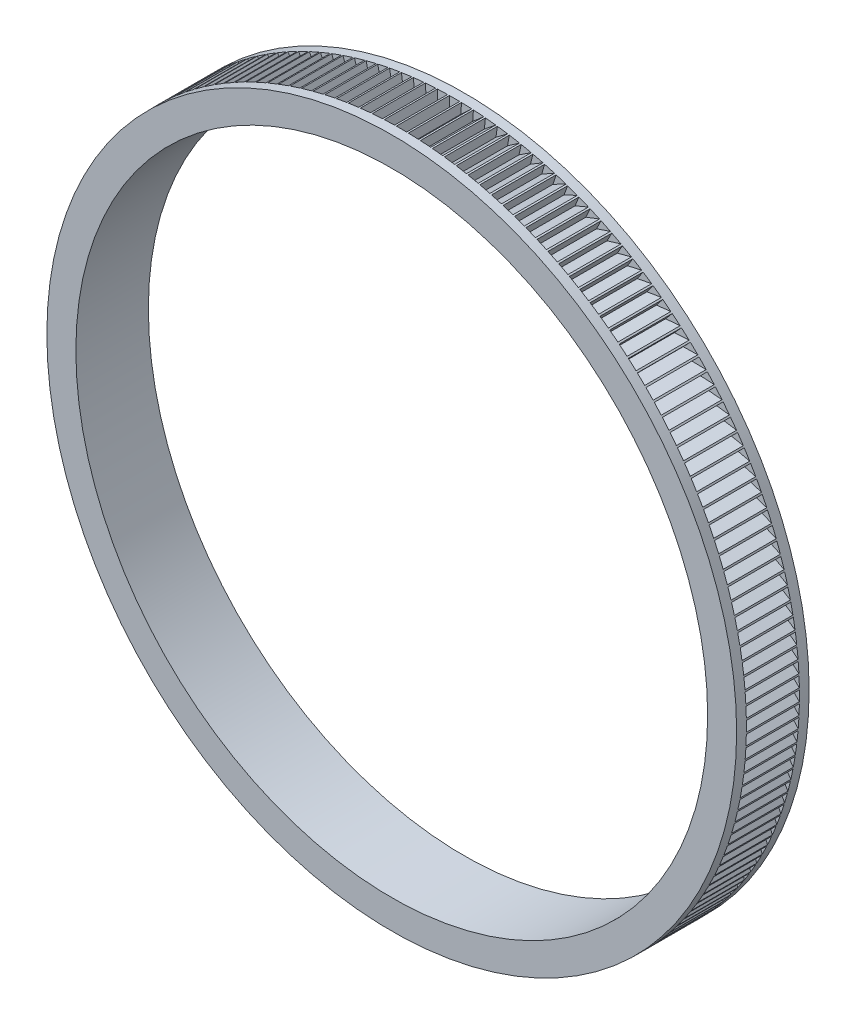
from build123d import *

# Parameters (mm, degrees)
CROQUIS1_R              = 33.3
CROQUIS1_R_2            = 30.5
SALIENTE_EXTRUIR2_DEPTH = 7
CROQUIS5_W              = 1
CROQUIS5_H              = 5.122199178
CORTAR_EXTRUIR5_DEPTH   = 1.8
CHAFL_N2_SIZE           = 1.1
MATRIZC3_START          = 0.938900411
MATRIZC3_DEPTH          = 5.122199178


# Read off the part's stored shape, not the designer's step: MatrizC3
with BuildPart() as part:
    # Croquis1 → Saliente-Extruir2 (new body)
    with BuildSketch(Plane.XY):
        Circle(CROQUIS1_R)
        Circle(CROQUIS1_R_2, mode=Mode.SUBTRACT)
    extrude(amount=SALIENTE_EXTRUIR2_DEPTH)

    # Croquis5 → Cortar-Extruir5 (cut)
    with BuildSketch(Plane(origin=(0, 34, 0), x_dir=(1, 0, 0), z_dir=(0, 1, 0))):
        with Locations((0, -3.5)):
            Rectangle(CROQUIS5_W, CROQUIS5_H)
    extrude(amount=-CORTAR_EXTRUIR5_DEPTH, mode=Mode.SUBTRACT)

    # Chaflán2
    # the kernel refuses this chamfer: 1.1 mm, written as the material it adds along each edge
    with BuildSketch(Plane(origin=(0.5, 32.2, 6.061099589), x_dir=(0.02749587661058642, 0.9996219169112969, 0), z_dir=(0, 0, -1))) as chafl_n2_piece_1_section:
        Polygon((CHAFL_N2_SIZE * 0.999621916911, -CHAFL_N2_SIZE * 0.0274958766106), (-CHAFL_N2_SIZE * 0.0274958766106, -CHAFL_N2_SIZE * 0.999621916911), (0, 0), align=None)
    chafl_n2_piece_1 = extrude(amount=5.122199179, mode=Mode.PRIVATE)
    chafl_n2_piece_1 = chafl_n2_piece_1 & Plane(origin=(0, 0, 3.5), x_dir=(1, 0, 0), z_dir=(0, 0, -1)) * Cylinder(33.3, 15, mode=Mode.PRIVATE)
    add(chafl_n2_piece_1)

    # MatrizC3 outline → MatrizC3 (cut)
    with BuildSketch(Plane.XY.offset(MATRIZC3_START)):
        with BuildLine():
            ThreePointArc((1.658023197, 33.258697495), (1.160304843, 33.279779036), (0.662326815, 33.29341261))
            Line((0.662326815, 33.29341261), (0.62755833, 32.297773461))
            Line((0.62755833, 32.297773461), (1.658023197, 33.258697495))
        make_face()
        with BuildLine():
            Line((-1.626949157, 32.262873964), (-0.666025123, 33.293338831))
            ThreePointArc((-0.666025123, 33.293338831), (-1.164001633, 33.279649941), (-1.661717642, 33.258513113))
            Line((-1.661717642, 33.258513113), (-1.626949157, 32.262873964))
        make_face()
        with BuildLine():
            ThreePointArc((2.817724978, 33.18057302), (2.321045556, 33.219011839), (1.823846687, 33.25001629))
            Line((1.823846687, 33.25001629), (1.754352077, 32.25619706))
            Line((1.754352077, 32.25619706), (2.817724978, 33.18057302))
        make_face()
        with BuildLine():
            Line((-2.751916127, 32.186440587), (-1.827540167, 33.249813487))
            ThreePointArc((-1.827540167, 33.249813487), (-2.324735588, 33.218753806), (-2.821410737, 33.180259816))
            Line((-2.821410737, 33.180259816), (-2.751916127, 32.186440587))
        make_face()
        with BuildLine():
            ThreePointArc((3.973993794, 33.062023128), (3.478958431, 33.117772392), (2.983144483, 33.166109947))
            Line((2.983144483, 33.166109947), (2.879008416, 32.175321452))
            Line((2.879008416, 32.175321452), (3.973993794, 33.062023128))
        make_face()
        with BuildLine():
            Line((-3.873530311, 32.070792989), (-2.986828635, 33.165778367))
            ThreePointArc((-2.986828635, 33.165778367), (-3.482637211, 33.117385737), (-3.977666378, 33.061581483))
            Line((-3.977666378, 33.061581483), (-3.873530311, 32.070792989))
        make_face()
        with BuildLine():
            ThreePointArc((5.125420912, 32.903192254), (4.632632733, 32.976184042), (4.138807777, 33.041795808))
            Line((4.138807777, 33.041795808), (4.000157127, 32.055245171))
            Line((4.000157127, 32.055245171), (5.125420912, 32.903192254))
        make_face()
        with BuildLine():
            Line((-4.990425195, 31.91607207), (-4.142478113, 33.041335855))
            ThreePointArc((-4.142478113, 33.041335855), (-4.636295777, 32.975669235), (-5.129075845, 32.902622707))
            Line((-5.129075845, 32.902622707), (-4.990425195, 31.91607207))
        make_face()
        with BuildLine():
            ThreePointArc((6.270603493, 32.704273908), (5.780662884, 32.794419291), (5.289428571, 32.87722533))
            Line((5.289428571, 32.87722533), (5.116432262, 31.896114511))
            Line((5.116432262, 31.896114511), (6.270603493, 32.704273908))
        make_face()
        with BuildLine():
            Line((-6.101240015, 31.722466333), (-5.293080619, 32.876637565))
            ThreePointArc((-5.293080619, 32.876637565), (-5.784305731, 32.793776959), (-6.274236324, 32.703577152))
            Line((-6.274236324, 32.703577152), (-6.101240015, 31.722466333))
        make_face()
        with BuildLine():
            ThreePointArc((7.408146311, 32.465510442), (6.921650189, 32.572699591), (6.433605011, 32.672599018))
            Line((6.433605011, 32.672599018), (6.226473813, 31.698123349))
            Line((6.226473813, 31.698123349), (7.408146311, 32.465510442))
        make_face()
        with BuildLine():
            Line((-7.204621414, 31.490211658), (-6.437234321, 32.671884156))
            ThreePointArc((-6.437234321, 32.671884156), (-6.925268399, 32.571930517), (-7.411752611, 32.464687327))
            Line((-7.411752611, 32.464687327), (-7.204621414, 31.490211658))
        make_face()
        with BuildLine():
            ThreePointArc((8.536663443, 32.187192752), (8.054204528, 32.311295075), (7.569943094, 32.428166176))
            Line((7.569943094, 32.428166176), (7.328929365, 31.461512907))
            Line((7.328929365, 31.461512907), (8.536663443, 32.187192752))
        make_face()
        with BuildLine():
            Line((-8.299225091, 31.219591011), (-7.573545245, 32.427325089))
            ThreePointArc((-7.573545245, 32.427325089), (-8.057793694, 32.310400195), (-8.54023882, 32.186244281))
            Line((-8.54023882, 32.186244281), (-8.299225091, 31.219591011))
        make_face()
        with BuildLine():
            ThreePointArc((9.654779965, 31.869659926), (9.17694606, 32.010524223), (8.697058368, 32.144224609))
            Line((8.697058368, 32.144224609), (8.422455745, 31.186571457))
            Line((8.422455745, 31.186571457), (9.654779965, 31.869659926))
        make_face()
        with BuildLine():
            Line((-9.383717441, 30.910934101), (-8.700628971, 32.143258321))
            ThreePointArc((-8.700628971, 32.143258321), (-9.180501809, 32.009504628), (-9.658320064, 31.868587254))
            Line((-9.658320064, 31.868587254), (-9.383717441, 30.910934101))
        make_face()
        with BuildLine():
            ThreePointArc((10.761133626, 31.513298829), (10.288506897, 31.670753477), (9.813577615, 31.821120257))
            Line((9.813577615, 31.821120257), (9.50572066, 30.873633974))
            Line((9.50572066, 30.873633974), (10.761133626, 31.513298829))
        make_face()
        with BuildLine():
            Line((-10.456777176, 30.564616979), (-9.817112321, 31.820029945))
            ThreePointArc((-9.817112321, 31.820029945), (-10.292024897, 31.66961041), (-10.764634132, 31.512103262))
            Line((-10.764634132, 31.512103262), (-10.456777176, 30.564616979))
        make_face()
        with BuildLine():
            ThreePointArc((11.854376502, 31.118543631), (11.387532773, 31.292396798), (10.918140531, 31.45924677))
            Line((10.918140531, 31.45924677), (10.577404319, 30.523081723))
            Line((10.577404319, 30.523081723), (11.854376502, 31.118543631))
        make_face()
        with BuildLine():
            Line((-11.51709694, 30.18106158), (-10.921635031, 31.458033763))
            ThreePointArc((-10.921635031, 31.458033763), (-11.391008737, 31.29113165), (-11.857833151, 31.117226627))
            Line((-11.857833151, 31.117226627), (-11.51709694, 30.18106158))
        make_face()
        with BuildLine():
            ThreePointArc((12.933176647, 30.685875282), (12.472684694, 30.875915153), (12.009401373, 31.059045038))
            Line((12.009401373, 31.059045038), (11.63620104, 30.135341799))
            Line((11.63620104, 30.135341799), (12.933176647, 30.685875282))
        make_face()
        with BuildLine():
            Line((-12.563384895, 29.760735206), (-12.012851412, 31.057710813))
            ThreePointArc((-12.012851412, 31.057710813), (-12.476114388, 30.874529466), (-12.936585228, 30.684438444))
            Line((-12.936585228, 30.684438444), (-12.563384895, 29.760735206))
        make_face()
        with BuildLine():
            ThreePointArc((13.996219709, 30.21582092), (13.542640571, 30.421815961), (13.08603061, 30.621002643))
            Line((13.08603061, 30.621002643), (12.680820843, 29.710886603))
            Line((12.680820843, 29.710886603), (13.996219709, 30.21582092))
        make_face()
        with BuildLine():
            Line((-13.5943663, 29.30414996), (-13.089431984, 30.619548827))
            ThreePointArc((-13.089431984, 30.619548827), (-13.546019816, 30.420311424), (-13.999576068, 30.214266))
            Line((-13.999576068, 30.214266), (-13.5943663, 29.30414996))
        make_face()
        with BuildLine():
            ThreePointArc((15.042210532, 29.708953235), (14.596096826, 29.930652473), (14.146716535, 30.145653273))
            Line((14.146716535, 30.145653273), (13.709991018, 29.250233269))
            Line((13.709991018, 29.250233269), (15.042210532, 29.708953235))
        make_face()
        with BuildLine():
            Line((-14.608785064, 28.811862122), (-14.150065099, 30.144081636))
            ThreePointArc((-14.150065099, 30.144081636), (-14.599421505, 29.929030919), (-15.045510581, 29.707282127))
            Line((-15.045510581, 29.707282127), (-14.608785064, 28.811862122))
        make_face()
        with BuildLine():
            ThreePointArc((16.06987474, 29.165889766), (15.631769986, 29.403023095), (15.190166864, 29.633576069))
            Line((15.190166864, 29.633576069), (14.722457682, 28.753943031))
            Line((14.722457682, 28.753943031), (16.06987474, 29.165889766))
        make_face()
        with BuildLine():
            Line((-15.605405274, 28.284471468), (-15.193458539, 29.631888526))
            ThreePointArc((-15.193458539, 29.631888526), (-15.635036047, 29.401286499), (-16.073114457, 29.164104506))
            Line((-16.073114457, 29.164104506), (-15.605405274, 28.284471468))
        make_face()
        with BuildLine():
            ThreePointArc((17.07796028, 28.587292154), (16.648398241, 28.839570663), (16.215110315, 29.085394917))
            Line((16.215110315, 29.085394917), (15.716987298, 28.222620542))
            Line((15.716987298, 28.222620542), (17.07796028, 28.587292154))
        make_face()
        with BuildLine():
            Line((-16.583012702, 27.722620542), (-16.21834109, 29.083593524))
            ThreePointArc((-16.21834109, 29.083593524), (-16.651601707, 28.837721141), (-17.081135719, 28.585394917))
            Line((-17.081135719, 28.585394917), (-16.583012702, 27.722620542))
        make_face()
        with BuildLine():
            ThreePointArc((18.065238956, 27.973865329), (17.644742988, 28.240981656), (17.220298152, 28.501777691))
            Line((17.220298152, 28.501777691), (16.692368187, 27.656913138))
            Line((16.692368187, 27.656913138), (18.065238956, 27.973865329))
        make_face()
        with BuildLine():
            Line((-17.540416283, 27.126993874), (-17.223464092, 28.499864643))
            ThreePointArc((-17.223464092, 28.499864643), (-17.647879955, 28.239021461), (-18.068346248, 27.971858427))
            Line((-18.068346248, 27.971858427), (-17.540416283, 27.126993874))
        make_face()
        with BuildLine():
            ThreePointArc((19.030507922, 27.326356659), (18.619590334, 27.607985363), (18.204505709, 27.883435439))
            Line((18.204505709, 27.883435439), (17.647411996, 27.057510045))
            Line((17.647411996, 27.057510045), (19.030507922, 27.326356659))
        make_face()
        with BuildLine():
            Line((-18.476449568, 26.498317142), (-18.207602955, 27.881413068))
            ThreePointArc((-18.207602955, 27.881413068), (-18.62265698, 27.605916884), (-19.033543281, 27.324242536))
            Line((-19.033543281, 27.324242536), (-18.476449568, 26.498317142))
        make_face()
        with BuildLine():
            ThreePointArc((19.972591144, 26.645555032), (19.571752577, 26.941352993), (19.166533879, 27.231121517))
            Line((19.166533879, 27.231121517), (18.580955152, 26.425141544))
            Line((18.580955152, 26.425141544), (19.972591144, 26.645555032))
        make_face()
        with BuildLine():
            Line((-19.389972146, 25.837356292), (-19.169558658, 27.228992285))
            ThreePointArc((-19.169558658, 27.228992285), (-19.574745165, 26.93917875), (-19.975550873, 26.643336265))
            Line((-19.975550873, 26.643336265), (-19.389972146, 25.837356292))
        make_face()
        with BuildLine():
            ThreePointArc((20.890340842, 25.932289901), (20.500069654, 26.241896734), (20.10521058, 26.545630668))
            Line((20.10521058, 26.545630668), (19.491860276, 25.760578079))
            Line((19.491860276, 25.760578079), (20.890340842, 25.932289901))
        make_face()
        with BuildLine():
            Line((-20.27987103, 25.144916604), (-20.108159208, 26.543397169))
            ThreePointArc((-20.108159208, 26.543397169), (-20.50298454, 26.239619375), (-20.893221333, 25.929969192))
            Line((-20.893221333, 25.929969192), (-20.27987103, 25.144916604))
        make_face()
        with BuildLine():
            ThreePointArc((21.782638876, 25.18743027), (21.403410554, 25.510468766), (21.019392179, 25.827798056))
            Line((21.019392179, 25.827798056), (20.379017571, 25.064629318))
            Line((20.379017571, 25.064629318), (21.782638876, 25.18743027))
        make_face()
        with BuildLine():
            Line((-21.145062014, 24.421841708), (-21.022261062, 25.825463013))
            ThreePointArc((-21.022261062, 25.825463013), (-21.406244185, 25.508091067), (-21.785436622, 25.185010447))
            Line((-21.785436622, 25.185010447), (-21.145062014, 24.421841708))
        make_face()
        with BuildLine():
            ThreePointArc((22.648398121, 24.411883634), (22.280674695, 24.747960222), (21.907964886, 25.078498252))
            Line((21.907964886, 25.078498252), (21.241346173, 24.338143166))
            Line((21.241346173, 24.338143166), (22.648398121, 24.411883634))
        make_face()
        with BuildLine():
            Line((-21.984490998, 23.66901256), (-21.91075053, 25.076064508))
            ThreePointArc((-21.91075053, 25.076064508), (-22.28342362, 24.745485079), (-22.651109711, 24.409367645))
            Line((-22.651109711, 24.409367645), (-21.984490998, 23.66901256))
        make_face()
        with BuildLine():
            ThreePointArc((23.486563781, 23.606594879), (23.130793266, 23.9553001), (22.769846113, 24.29864416))
            Line((22.769846113, 24.29864416), (22.077795466, 23.582004736))
            Line((22.077795466, 23.582004736), (23.486563781, 23.606594879))
        make_face()
        with BuildLine():
            Line((-22.797135266, 22.887346366), (-22.772545124, 24.296114681))
            ThreePointArc((-22.772545124, 24.296114681), (-23.133454135, 23.952730528), (-23.489185913, 23.603985789))
            Line((-23.489185913, 23.603985789), (-22.797135266, 22.887346366))
        make_face()
        with BuildLine():
            ThreePointArc((24.296114681, 22.772545124), (23.952730528, 23.133454135), (23.603985789, 23.489185913))
            Line((23.603985789, 23.489185913), (22.887346366, 22.797135266))
            Line((22.887346366, 22.797135266), (24.296114681, 22.772545124))
        make_face()
        with BuildLine():
            Line((-23.582004736, 22.077795466), (-23.606594879, 23.486563781))
            ThreePointArc((-23.606594879, 23.486563781), (-23.9553001, 23.130793266), (-24.29864416, 22.769846113))
            Line((-24.29864416, 22.769846113), (-23.582004736, 22.077795466))
        make_face()
        with BuildLine():
            ThreePointArc((25.076064508, 21.91075053), (24.745485079, 22.28342362), (24.409367645, 22.651109711))
            Line((24.409367645, 22.651109711), (23.66901256, 21.984490998))
            Line((23.66901256, 21.984490998), (25.076064508, 21.91075053))
        make_face()
        with BuildLine():
            Line((-24.338143166, 21.241346173), (-24.411883634, 22.648398121))
            ThreePointArc((-24.411883634, 22.648398121), (-24.747960222, 22.280674695), (-25.078498252, 21.907964886))
            Line((-25.078498252, 21.907964886), (-24.338143166, 21.241346173))
        make_face()
        with BuildLine():
            ThreePointArc((25.825463013, 21.022261062), (25.508091067, 21.406244185), (25.185010447, 21.785436622))
            Line((25.185010447, 21.785436622), (24.421841708, 21.145062014))
            Line((24.421841708, 21.145062014), (25.825463013, 21.022261062))
        make_face()
        with BuildLine():
            Line((-25.064629318, 20.379017571), (-25.18743027, 21.782638876))
            ThreePointArc((-25.18743027, 21.782638876), (-25.510468766, 21.403410554), (-25.827798056, 21.019392179))
            Line((-25.827798056, 21.019392179), (-25.064629318, 20.379017571))
        make_face()
        with BuildLine():
            ThreePointArc((26.543397169, 20.108159208), (26.239619375, 20.50298454), (25.929969192, 20.893221333))
            Line((25.929969192, 20.893221333), (25.144916604, 20.27987103))
            Line((25.144916604, 20.27987103), (26.543397169, 20.108159208))
        make_face()
        with BuildLine():
            Line((-25.760578079, 19.491860276), (-25.932289901, 20.890340842))
            ThreePointArc((-25.932289901, 20.890340842), (-26.241896734, 20.500069654), (-26.545630668, 20.10521058))
            Line((-26.545630668, 20.10521058), (-25.760578079, 19.491860276))
        make_face()
        with BuildLine():
            ThreePointArc((27.228992285, 19.169558658), (26.93917875, 19.574745165), (26.643336265, 19.975550873))
            Line((26.643336265, 19.975550873), (25.837356292, 19.389972146))
            Line((25.837356292, 19.389972146), (27.228992285, 19.169558658))
        make_face()
        with BuildLine():
            Line((-26.425141544, 18.580955152), (-26.645555032, 19.972591144))
            ThreePointArc((-26.645555032, 19.972591144), (-26.941352993, 19.571752577), (-27.231121517, 19.166533879))
            Line((-27.231121517, 19.166533879), (-26.425141544, 18.580955152))
        make_face()
        with BuildLine():
            ThreePointArc((27.881413068, 18.207602955), (27.605916884, 18.62265698), (27.324242536, 19.033543281))
            Line((27.324242536, 19.033543281), (26.498317142, 18.476449568))
            Line((26.498317142, 18.476449568), (27.881413068, 18.207602955))
        make_face()
        with BuildLine():
            Line((-27.057510045, 17.647411996), (-27.326356659, 19.030507922))
            ThreePointArc((-27.326356659, 19.030507922), (-27.607985363, 18.619590334), (-27.883435439, 18.204505709))
            Line((-27.883435439, 18.204505709), (-27.057510045, 17.647411996))
        make_face()
        with BuildLine():
            ThreePointArc((28.499864643, 17.223464092), (28.239021461, 17.647879955), (27.971858427, 18.068346248))
            Line((27.971858427, 18.068346248), (27.126993874, 17.540416283))
            Line((27.126993874, 17.540416283), (28.499864643, 17.223464092))
        make_face()
        with BuildLine():
            Line((-27.656913138, 16.692368187), (-27.973865329, 18.065238956))
            ThreePointArc((-27.973865329, 18.065238956), (-28.240981656, 17.644742988), (-28.501777691, 17.220298152))
            Line((-28.501777691, 17.220298152), (-27.656913138, 16.692368187))
        make_face()
        with BuildLine():
            ThreePointArc((29.083593524, 16.21834109), (28.837721141, 16.651601707), (28.585394917, 17.081135719))
            Line((28.585394917, 17.081135719), (27.722620542, 16.583012702))
            Line((27.722620542, 16.583012702), (29.083593524, 16.21834109))
        make_face()
        with BuildLine():
            Line((-28.222620542, 15.716987298), (-28.587292154, 17.07796028))
            ThreePointArc((-28.587292154, 17.07796028), (-28.839570663, 16.648398241), (-29.085394917, 16.215110315))
            Line((-29.085394917, 16.215110315), (-28.222620542, 15.716987298))
        make_face()
        with BuildLine():
            ThreePointArc((29.631888526, 15.193458539), (29.401286499, 15.635036047), (29.164104506, 16.073114457))
            Line((29.164104506, 16.073114457), (28.284471468, 15.605405274))
            Line((28.284471468, 15.605405274), (29.631888526, 15.193458539))
        make_face()
        with BuildLine():
            Line((-28.753943031, 14.722457682), (-29.165889766, 16.06987474))
            ThreePointArc((-29.165889766, 16.06987474), (-29.403023095, 15.631769986), (-29.633576069, 15.190166864))
            Line((-29.633576069, 15.190166864), (-28.753943031, 14.722457682))
        make_face()
        with BuildLine():
            ThreePointArc((30.144081636, 14.150065099), (29.929030919, 14.599421505), (29.707282127, 15.045510581))
            Line((29.707282127, 15.045510581), (28.811862122, 14.608785064))
            Line((28.811862122, 14.608785064), (30.144081636, 14.150065099))
        make_face()
        with BuildLine():
            Line((-29.250233269, 13.709991018), (-29.708953235, 15.042210532))
            ThreePointArc((-29.708953235, 15.042210532), (-29.930652473, 14.596096826), (-30.145653273, 14.146716535))
            Line((-30.145653273, 14.146716535), (-29.250233269, 13.709991018))
        make_face()
        with BuildLine():
            ThreePointArc((30.619548827, 13.089431984), (30.420311424, 13.546019816), (30.214266, 13.999576068))
            Line((30.214266, 13.999576068), (29.30414996, 13.5943663))
            Line((29.30414996, 13.5943663), (30.619548827, 13.089431984))
        make_face()
        with BuildLine():
            Line((-29.710886603, 12.680820843), (-30.21582092, 13.996219709))
            ThreePointArc((-30.21582092, 13.996219709), (-30.421815961, 13.542640571), (-30.621002643, 13.08603061))
            Line((-30.621002643, 13.08603061), (-29.710886603, 12.680820843))
        make_face()
        with BuildLine():
            ThreePointArc((31.057710813, 12.012851412), (30.874529466, 12.476114388), (30.684438444, 12.936585228))
            Line((30.684438444, 12.936585228), (29.760735206, 12.563384895))
            Line((29.760735206, 12.563384895), (31.057710813, 12.012851412))
        make_face()
        with BuildLine():
            Line((-30.135341799, 11.63620104), (-30.685875282, 12.933176647))
            ThreePointArc((-30.685875282, 12.933176647), (-30.875915153, 12.472684694), (-31.059045038, 12.009401373))
            Line((-31.059045038, 12.009401373), (-30.135341799, 11.63620104))
        make_face()
        with BuildLine():
            ThreePointArc((31.458033763, 10.921635031), (31.29113165, 11.391008737), (31.117226627, 11.857833151))
            Line((31.117226627, 11.857833151), (30.18106158, 11.51709694))
            Line((30.18106158, 11.51709694), (31.458033763, 10.921635031))
        make_face()
        with BuildLine():
            Line((-30.523081723, 10.577404319), (-31.118543631, 11.854376502))
            ThreePointArc((-31.118543631, 11.854376502), (-31.292396798, 11.387532773), (-31.45924677, 10.918140531))
            Line((-31.45924677, 10.918140531), (-30.523081723, 10.577404319))
        make_face()
        with BuildLine():
            ThreePointArc((31.820029945, 9.817112321), (31.66961041, 10.292024897), (31.512103262, 10.764634132))
            Line((31.512103262, 10.764634132), (30.564616979, 10.456777176))
            Line((30.564616979, 10.456777176), (31.820029945, 9.817112321))
        make_face()
        with BuildLine():
            Line((-30.873633974, 9.50572066), (-31.513298829, 10.761133626))
            ThreePointArc((-31.513298829, 10.761133626), (-31.670753477, 10.288506897), (-31.821120257, 9.813577615))
            Line((-31.821120257, 9.813577615), (-30.873633974, 9.50572066))
        make_face()
        with BuildLine():
            ThreePointArc((32.143258321, 8.700628971), (32.009504628, 9.180501809), (31.868587254, 9.658320064))
            Line((31.868587254, 9.658320064), (30.910934101, 9.383717441))
            Line((30.910934101, 9.383717441), (32.143258321, 8.700628971))
        make_face()
        with BuildLine():
            Line((-31.186571457, 8.422455745), (-31.869659926, 9.654779965))
            ThreePointArc((-31.869659926, 9.654779965), (-32.010524223, 9.17694606), (-32.144224609, 8.697058368))
            Line((-32.144224609, 8.697058368), (-31.186571457, 8.422455745))
        make_face()
        with BuildLine():
            ThreePointArc((32.427325089, 7.573545245), (32.310400195, 8.057793694), (32.186244281, 8.54023882))
            Line((32.186244281, 8.54023882), (31.219591011, 8.299225091))
            Line((31.219591011, 8.299225091), (32.427325089, 7.573545245))
        make_face()
        with BuildLine():
            Line((-31.461512907, 7.328929365), (-32.187192752, 8.536663443))
            ThreePointArc((-32.187192752, 8.536663443), (-32.311295075, 8.054204528), (-32.428166176, 7.569943094))
            Line((-32.428166176, 7.569943094), (-31.461512907, 7.328929365))
        make_face()
        with BuildLine():
            ThreePointArc((32.671884156, 6.437234321), (32.571930517, 6.925268399), (32.464687327, 7.411752611))
            Line((32.464687327, 7.411752611), (31.490211658, 7.204621414))
            Line((31.490211658, 7.204621414), (32.671884156, 6.437234321))
        make_face()
        with BuildLine():
            Line((-31.698123349, 6.226473813), (-32.465510442, 7.408146311))
            ThreePointArc((-32.465510442, 7.408146311), (-32.572699591, 6.921650189), (-32.672599018, 6.433605011))
            Line((-32.672599018, 6.433605011), (-31.698123349, 6.226473813))
        make_face()
        with BuildLine():
            ThreePointArc((32.876637565, 5.293080619), (32.793776959, 5.784305731), (32.703577152, 6.274236324))
            Line((32.703577152, 6.274236324), (31.722466333, 6.101240015))
            Line((31.722466333, 6.101240015), (32.876637565, 5.293080619))
        make_face()
        with BuildLine():
            Line((-31.896114511, 5.116432262), (-32.704273908, 6.270603493))
            ThreePointArc((-32.704273908, 6.270603493), (-32.794419291, 5.780662884), (-32.87722533, 5.289428571))
            Line((-32.87722533, 5.289428571), (-31.896114511, 5.116432262))
        make_face()
        with BuildLine():
            ThreePointArc((33.041335855, 4.142478113), (32.975669235, 4.636295777), (32.902622707, 5.129075845))
            Line((32.902622707, 5.129075845), (31.91607207, 4.990425195))
            Line((31.91607207, 4.990425195), (33.041335855, 4.142478113))
        make_face()
        with BuildLine():
            Line((-32.055245171, 4.000157127), (-32.903192254, 5.125420912))
            ThreePointArc((-32.903192254, 5.125420912), (-32.976184042, 4.632632733), (-33.041795808, 4.138807777))
            Line((-33.041795808, 4.138807777), (-32.055245171, 4.000157127))
        make_face()
        with BuildLine():
            ThreePointArc((33.165778367, 2.986828635), (33.117385737, 3.482637211), (33.061581483, 3.977666378))
            Line((33.061581483, 3.977666378), (32.070792989, 3.873530311))
            Line((32.070792989, 3.873530311), (33.165778367, 2.986828635))
        make_face()
        with BuildLine():
            Line((-32.175321452, 2.879008416), (-33.062023128, 3.973993794))
            ThreePointArc((-33.062023128, 3.973993794), (-33.117772392, 3.478958431), (-33.166109947, 2.983144483))
            Line((-33.166109947, 2.983144483), (-32.175321452, 2.879008416))
        make_face()
        with BuildLine():
            ThreePointArc((33.249813487, 1.827540167), (33.218753806, 2.324735588), (33.180259816, 2.821410737))
            Line((33.180259816, 2.821410737), (32.186440587, 2.751916127))
            Line((32.186440587, 2.751916127), (33.249813487, 1.827540167))
        make_face()
        with BuildLine():
            Line((-32.25619706, 1.754352077), (-33.18057302, 2.817724978))
            ThreePointArc((-33.18057302, 2.817724978), (-33.219011839, 2.321045556), (-33.25001629, 1.823846687))
            Line((-33.25001629, 1.823846687), (-32.25619706, 1.754352077))
        make_face()
        with BuildLine():
            ThreePointArc((33.293338831, 0.666025123), (33.279649941, 1.164001633), (33.258513113, 1.661717642))
            Line((33.258513113, 1.661717642), (32.262873964, 1.626949157))
            Line((32.262873964, 1.626949157), (33.293338831, 0.666025123))
        make_face()
        with BuildLine():
            Line((-32.297773461, 0.62755833), (-33.258697495, 1.658023197))
            ThreePointArc((-33.258697495, 1.658023197), (-33.279779036, 1.160304843), (-33.29341261, 0.662326815))
            Line((-33.29341261, 0.662326815), (-32.297773461, 0.62755833))
        make_face()
        with BuildLine():
            ThreePointArc((33.29630137, -0.49630137), (33.299999949, 0.001849522), (33.296246035, 0.5))
            Line((33.296246035, 0.5), (32.3, 0.5))
            Line((32.3, 0.5), (33.29630137, -0.49630137))
        make_face()
        with BuildLine():
            Line((-32.3, -0.5), (-33.29630137, 0.49630137))
            ThreePointArc((-33.29630137, 0.49630137), (-33.299999949, -0.001849522), (-33.296246035, -0.5))
            Line((-33.296246035, -0.5), (-32.3, -0.5))
        make_face()
        with BuildLine():
            ThreePointArc((33.258697495, -1.658023197), (33.279779036, -1.160304843), (33.29341261, -0.662326815))
            Line((33.29341261, -0.662326815), (32.297773461, -0.62755833))
            Line((32.297773461, -0.62755833), (33.258697495, -1.658023197))
        make_face()
        with BuildLine():
            Line((-32.262873964, -1.626949157), (-33.293338831, -0.666025123))
            ThreePointArc((-33.293338831, -0.666025123), (-33.279649941, -1.164001633), (-33.258513113, -1.661717642))
            Line((-33.258513113, -1.661717642), (-32.262873964, -1.626949157))
        make_face()
        with BuildLine():
            ThreePointArc((33.18057302, -2.817724978), (33.219011839, -2.321045556), (33.25001629, -1.823846687))
            Line((33.25001629, -1.823846687), (32.25619706, -1.754352077))
            Line((32.25619706, -1.754352077), (33.18057302, -2.817724978))
        make_face()
        with BuildLine():
            Line((-32.186440587, -2.751916127), (-33.249813487, -1.827540167))
            ThreePointArc((-33.249813487, -1.827540167), (-33.218753806, -2.324735588), (-33.180259816, -2.821410737))
            Line((-33.180259816, -2.821410737), (-32.186440587, -2.751916127))
        make_face()
        with BuildLine():
            ThreePointArc((33.062023128, -3.973993794), (33.117772392, -3.478958431), (33.166109947, -2.983144483))
            Line((33.166109947, -2.983144483), (32.175321452, -2.879008416))
            Line((32.175321452, -2.879008416), (33.062023128, -3.973993794))
        make_face()
        with BuildLine():
            Line((-32.070792989, -3.873530311), (-33.165778367, -2.986828635))
            ThreePointArc((-33.165778367, -2.986828635), (-33.117385737, -3.482637211), (-33.061581483, -3.977666378))
            Line((-33.061581483, -3.977666378), (-32.070792989, -3.873530311))
        make_face()
        with BuildLine():
            ThreePointArc((32.903192254, -5.125420912), (32.976184042, -4.632632733), (33.041795808, -4.138807777))
            Line((33.041795808, -4.138807777), (32.055245171, -4.000157127))
            Line((32.055245171, -4.000157127), (32.903192254, -5.125420912))
        make_face()
        with BuildLine():
            Line((-31.91607207, -4.990425195), (-33.041335855, -4.142478113))
            ThreePointArc((-33.041335855, -4.142478113), (-32.975669235, -4.636295777), (-32.902622707, -5.129075845))
            Line((-32.902622707, -5.129075845), (-31.91607207, -4.990425195))
        make_face()
        with BuildLine():
            ThreePointArc((32.704273908, -6.270603493), (32.794419291, -5.780662884), (32.87722533, -5.289428571))
            Line((32.87722533, -5.289428571), (31.896114511, -5.116432262))
            Line((31.896114511, -5.116432262), (32.704273908, -6.270603493))
        make_face()
        with BuildLine():
            Line((-31.722466333, -6.101240015), (-32.876637565, -5.293080619))
            ThreePointArc((-32.876637565, -5.293080619), (-32.793776959, -5.784305731), (-32.703577152, -6.274236324))
            Line((-32.703577152, -6.274236324), (-31.722466333, -6.101240015))
        make_face()
        with BuildLine():
            ThreePointArc((32.465510442, -7.408146311), (32.572699591, -6.921650189), (32.672599018, -6.433605011))
            Line((32.672599018, -6.433605011), (31.698123349, -6.226473813))
            Line((31.698123349, -6.226473813), (32.465510442, -7.408146311))
        make_face()
        with BuildLine():
            Line((-31.490211658, -7.204621414), (-32.671884156, -6.437234321))
            ThreePointArc((-32.671884156, -6.437234321), (-32.571930517, -6.925268399), (-32.464687327, -7.411752611))
            Line((-32.464687327, -7.411752611), (-31.490211658, -7.204621414))
        make_face()
        with BuildLine():
            ThreePointArc((32.187192752, -8.536663443), (32.311295075, -8.054204528), (32.428166176, -7.569943094))
            Line((32.428166176, -7.569943094), (31.461512907, -7.328929365))
            Line((31.461512907, -7.328929365), (32.187192752, -8.536663443))
        make_face()
        with BuildLine():
            Line((-31.219591011, -8.299225091), (-32.427325089, -7.573545245))
            ThreePointArc((-32.427325089, -7.573545245), (-32.310400195, -8.057793694), (-32.186244281, -8.54023882))
            Line((-32.186244281, -8.54023882), (-31.219591011, -8.299225091))
        make_face()
        with BuildLine():
            ThreePointArc((31.869659926, -9.654779965), (32.010524223, -9.17694606), (32.144224609, -8.697058368))
            Line((32.144224609, -8.697058368), (31.186571457, -8.422455745))
            Line((31.186571457, -8.422455745), (31.869659926, -9.654779965))
        make_face()
        with BuildLine():
            Line((-30.910934101, -9.383717441), (-32.143258321, -8.700628971))
            ThreePointArc((-32.143258321, -8.700628971), (-32.009504628, -9.180501809), (-31.868587254, -9.658320064))
            Line((-31.868587254, -9.658320064), (-30.910934101, -9.383717441))
        make_face()
        with BuildLine():
            ThreePointArc((31.513298829, -10.761133626), (31.670753477, -10.288506897), (31.821120257, -9.813577615))
            Line((31.821120257, -9.813577615), (30.873633974, -9.50572066))
            Line((30.873633974, -9.50572066), (31.513298829, -10.761133626))
        make_face()
        with BuildLine():
            Line((-30.564616979, -10.456777176), (-31.820029945, -9.817112321))
            ThreePointArc((-31.820029945, -9.817112321), (-31.66961041, -10.292024897), (-31.512103262, -10.764634132))
            Line((-31.512103262, -10.764634132), (-30.564616979, -10.456777176))
        make_face()
        with BuildLine():
            ThreePointArc((31.118543631, -11.854376502), (31.292396798, -11.387532773), (31.45924677, -10.918140531))
            Line((31.45924677, -10.918140531), (30.523081723, -10.577404319))
            Line((30.523081723, -10.577404319), (31.118543631, -11.854376502))
        make_face()
        with BuildLine():
            Line((-30.18106158, -11.51709694), (-31.458033763, -10.921635031))
            ThreePointArc((-31.458033763, -10.921635031), (-31.29113165, -11.391008737), (-31.117226627, -11.857833151))
            Line((-31.117226627, -11.857833151), (-30.18106158, -11.51709694))
        make_face()
        with BuildLine():
            ThreePointArc((30.685875282, -12.933176647), (30.875915153, -12.472684694), (31.059045038, -12.009401373))
            Line((31.059045038, -12.009401373), (30.135341799, -11.63620104))
            Line((30.135341799, -11.63620104), (30.685875282, -12.933176647))
        make_face()
        with BuildLine():
            Line((-29.760735206, -12.563384895), (-31.057710813, -12.012851412))
            ThreePointArc((-31.057710813, -12.012851412), (-30.874529466, -12.476114388), (-30.684438444, -12.936585228))
            Line((-30.684438444, -12.936585228), (-29.760735206, -12.563384895))
        make_face()
        with BuildLine():
            ThreePointArc((30.21582092, -13.996219709), (30.421815961, -13.542640571), (30.621002643, -13.08603061))
            Line((30.621002643, -13.08603061), (29.710886603, -12.680820843))
            Line((29.710886603, -12.680820843), (30.21582092, -13.996219709))
        make_face()
        with BuildLine():
            Line((-29.30414996, -13.5943663), (-30.619548827, -13.089431984))
            ThreePointArc((-30.619548827, -13.089431984), (-30.420311424, -13.546019816), (-30.214266, -13.999576068))
            Line((-30.214266, -13.999576068), (-29.30414996, -13.5943663))
        make_face()
        with BuildLine():
            ThreePointArc((29.708953235, -15.042210532), (29.930652473, -14.596096826), (30.145653273, -14.146716535))
            Line((30.145653273, -14.146716535), (29.250233269, -13.709991018))
            Line((29.250233269, -13.709991018), (29.708953235, -15.042210532))
        make_face()
        with BuildLine():
            Line((-28.811862122, -14.608785064), (-30.144081636, -14.150065099))
            ThreePointArc((-30.144081636, -14.150065099), (-29.929030919, -14.599421505), (-29.707282127, -15.045510581))
            Line((-29.707282127, -15.045510581), (-28.811862122, -14.608785064))
        make_face()
        with BuildLine():
            ThreePointArc((29.165889766, -16.06987474), (29.403023095, -15.631769986), (29.633576069, -15.190166864))
            Line((29.633576069, -15.190166864), (28.753943031, -14.722457682))
            Line((28.753943031, -14.722457682), (29.165889766, -16.06987474))
        make_face()
        with BuildLine():
            Line((-28.284471468, -15.605405274), (-29.631888526, -15.193458539))
            ThreePointArc((-29.631888526, -15.193458539), (-29.401286499, -15.635036047), (-29.164104506, -16.073114457))
            Line((-29.164104506, -16.073114457), (-28.284471468, -15.605405274))
        make_face()
        with BuildLine():
            ThreePointArc((28.587292154, -17.07796028), (28.839570663, -16.648398241), (29.085394917, -16.215110315))
            Line((29.085394917, -16.215110315), (28.222620542, -15.716987298))
            Line((28.222620542, -15.716987298), (28.587292154, -17.07796028))
        make_face()
        with BuildLine():
            Line((-27.722620542, -16.583012702), (-29.083593524, -16.21834109))
            ThreePointArc((-29.083593524, -16.21834109), (-28.837721141, -16.651601707), (-28.585394917, -17.081135719))
            Line((-28.585394917, -17.081135719), (-27.722620542, -16.583012702))
        make_face()
        with BuildLine():
            ThreePointArc((27.973865329, -18.065238956), (28.240981656, -17.644742988), (28.501777691, -17.220298152))
            Line((28.501777691, -17.220298152), (27.656913138, -16.692368187))
            Line((27.656913138, -16.692368187), (27.973865329, -18.065238956))
        make_face()
        with BuildLine():
            Line((-27.126993874, -17.540416283), (-28.499864643, -17.223464092))
            ThreePointArc((-28.499864643, -17.223464092), (-28.239021461, -17.647879955), (-27.971858427, -18.068346248))
            Line((-27.971858427, -18.068346248), (-27.126993874, -17.540416283))
        make_face()
        with BuildLine():
            ThreePointArc((27.326356659, -19.030507922), (27.607985363, -18.619590334), (27.883435439, -18.204505709))
            Line((27.883435439, -18.204505709), (27.057510045, -17.647411996))
            Line((27.057510045, -17.647411996), (27.326356659, -19.030507922))
        make_face()
        with BuildLine():
            Line((-26.498317142, -18.476449568), (-27.881413068, -18.207602955))
            ThreePointArc((-27.881413068, -18.207602955), (-27.605916884, -18.62265698), (-27.324242536, -19.033543281))
            Line((-27.324242536, -19.033543281), (-26.498317142, -18.476449568))
        make_face()
        with BuildLine():
            ThreePointArc((26.645555032, -19.972591144), (26.941352993, -19.571752577), (27.231121517, -19.166533879))
            Line((27.231121517, -19.166533879), (26.425141544, -18.580955152))
            Line((26.425141544, -18.580955152), (26.645555032, -19.972591144))
        make_face()
        with BuildLine():
            Line((-25.837356292, -19.389972146), (-27.228992285, -19.169558658))
            ThreePointArc((-27.228992285, -19.169558658), (-26.93917875, -19.574745165), (-26.643336265, -19.975550873))
            Line((-26.643336265, -19.975550873), (-25.837356292, -19.389972146))
        make_face()
        with BuildLine():
            ThreePointArc((25.932289901, -20.890340842), (26.241896734, -20.500069654), (26.545630668, -20.10521058))
            Line((26.545630668, -20.10521058), (25.760578079, -19.491860276))
            Line((25.760578079, -19.491860276), (25.932289901, -20.890340842))
        make_face()
        with BuildLine():
            Line((-25.144916604, -20.27987103), (-26.543397169, -20.108159208))
            ThreePointArc((-26.543397169, -20.108159208), (-26.239619375, -20.50298454), (-25.929969192, -20.893221333))
            Line((-25.929969192, -20.893221333), (-25.144916604, -20.27987103))
        make_face()
        with BuildLine():
            ThreePointArc((25.18743027, -21.782638876), (25.510468766, -21.403410554), (25.827798056, -21.019392179))
            Line((25.827798056, -21.019392179), (25.064629318, -20.379017571))
            Line((25.064629318, -20.379017571), (25.18743027, -21.782638876))
        make_face()
        with BuildLine():
            Line((-24.421841708, -21.145062014), (-25.825463013, -21.022261062))
            ThreePointArc((-25.825463013, -21.022261062), (-25.508091067, -21.406244185), (-25.185010447, -21.785436622))
            Line((-25.185010447, -21.785436622), (-24.421841708, -21.145062014))
        make_face()
        with BuildLine():
            ThreePointArc((24.411883634, -22.648398121), (24.747960222, -22.280674695), (25.078498252, -21.907964886))
            Line((25.078498252, -21.907964886), (24.338143166, -21.241346173))
            Line((24.338143166, -21.241346173), (24.411883634, -22.648398121))
        make_face()
        with BuildLine():
            Line((-23.66901256, -21.984490998), (-25.076064508, -21.91075053))
            ThreePointArc((-25.076064508, -21.91075053), (-24.745485079, -22.28342362), (-24.409367645, -22.651109711))
            Line((-24.409367645, -22.651109711), (-23.66901256, -21.984490998))
        make_face()
        with BuildLine():
            ThreePointArc((23.606594879, -23.486563781), (23.9553001, -23.130793266), (24.29864416, -22.769846113))
            Line((24.29864416, -22.769846113), (23.582004736, -22.077795466))
            Line((23.582004736, -22.077795466), (23.606594879, -23.486563781))
        make_face()
        with BuildLine():
            Line((-22.887346366, -22.797135266), (-24.296114681, -22.772545124))
            ThreePointArc((-24.296114681, -22.772545124), (-23.952730528, -23.133454135), (-23.603985789, -23.489185913))
            Line((-23.603985789, -23.489185913), (-22.887346366, -22.797135266))
        make_face()
        with BuildLine():
            ThreePointArc((22.772545124, -24.296114681), (23.133454135, -23.952730528), (23.489185913, -23.603985789))
            Line((23.489185913, -23.603985789), (22.797135266, -22.887346366))
            Line((22.797135266, -22.887346366), (22.772545124, -24.296114681))
        make_face()
        with BuildLine():
            Line((-22.077795466, -23.582004736), (-23.486563781, -23.606594879))
            ThreePointArc((-23.486563781, -23.606594879), (-23.130793266, -23.9553001), (-22.769846113, -24.29864416))
            Line((-22.769846113, -24.29864416), (-22.077795466, -23.582004736))
        make_face()
        with BuildLine():
            ThreePointArc((21.91075053, -25.076064508), (22.28342362, -24.745485079), (22.651109711, -24.409367645))
            Line((22.651109711, -24.409367645), (21.984490998, -23.66901256))
            Line((21.984490998, -23.66901256), (21.91075053, -25.076064508))
        make_face()
        with BuildLine():
            Line((-21.241346173, -24.338143166), (-22.648398121, -24.411883634))
            ThreePointArc((-22.648398121, -24.411883634), (-22.280674695, -24.747960222), (-21.907964886, -25.078498252))
            Line((-21.907964886, -25.078498252), (-21.241346173, -24.338143166))
        make_face()
        with BuildLine():
            ThreePointArc((21.022261062, -25.825463013), (21.406244185, -25.508091067), (21.785436622, -25.185010447))
            Line((21.785436622, -25.185010447), (21.145062014, -24.421841708))
            Line((21.145062014, -24.421841708), (21.022261062, -25.825463013))
        make_face()
        with BuildLine():
            Line((-20.379017571, -25.064629318), (-21.782638876, -25.18743027))
            ThreePointArc((-21.782638876, -25.18743027), (-21.403410554, -25.510468766), (-21.019392179, -25.827798056))
            Line((-21.019392179, -25.827798056), (-20.379017571, -25.064629318))
        make_face()
        with BuildLine():
            ThreePointArc((20.108159208, -26.543397169), (20.50298454, -26.239619375), (20.893221333, -25.929969192))
            Line((20.893221333, -25.929969192), (20.27987103, -25.144916604))
            Line((20.27987103, -25.144916604), (20.108159208, -26.543397169))
        make_face()
        with BuildLine():
            Line((-19.491860276, -25.760578079), (-20.890340842, -25.932289901))
            ThreePointArc((-20.890340842, -25.932289901), (-20.500069654, -26.241896734), (-20.10521058, -26.545630668))
            Line((-20.10521058, -26.545630668), (-19.491860276, -25.760578079))
        make_face()
        with BuildLine():
            ThreePointArc((19.169558658, -27.228992285), (19.574745165, -26.93917875), (19.975550873, -26.643336265))
            Line((19.975550873, -26.643336265), (19.389972146, -25.837356292))
            Line((19.389972146, -25.837356292), (19.169558658, -27.228992285))
        make_face()
        with BuildLine():
            Line((-18.580955152, -26.425141544), (-19.972591144, -26.645555032))
            ThreePointArc((-19.972591144, -26.645555032), (-19.571752577, -26.941352993), (-19.166533879, -27.231121517))
            Line((-19.166533879, -27.231121517), (-18.580955152, -26.425141544))
        make_face()
        with BuildLine():
            ThreePointArc((18.207602955, -27.881413068), (18.62265698, -27.605916884), (19.033543281, -27.324242536))
            Line((19.033543281, -27.324242536), (18.476449568, -26.498317142))
            Line((18.476449568, -26.498317142), (18.207602955, -27.881413068))
        make_face()
        with BuildLine():
            Line((-17.647411996, -27.057510045), (-19.030507922, -27.326356659))
            ThreePointArc((-19.030507922, -27.326356659), (-18.619590334, -27.607985363), (-18.204505709, -27.883435439))
            Line((-18.204505709, -27.883435439), (-17.647411996, -27.057510045))
        make_face()
        with BuildLine():
            ThreePointArc((17.223464092, -28.499864643), (17.647879955, -28.239021461), (18.068346248, -27.971858427))
            Line((18.068346248, -27.971858427), (17.540416283, -27.126993874))
            Line((17.540416283, -27.126993874), (17.223464092, -28.499864643))
        make_face()
        with BuildLine():
            Line((-16.692368187, -27.656913138), (-18.065238956, -27.973865329))
            ThreePointArc((-18.065238956, -27.973865329), (-17.644742988, -28.240981656), (-17.220298152, -28.501777691))
            Line((-17.220298152, -28.501777691), (-16.692368187, -27.656913138))
        make_face()
        with BuildLine():
            ThreePointArc((16.21834109, -29.083593524), (16.651601707, -28.837721141), (17.081135719, -28.585394917))
            Line((17.081135719, -28.585394917), (16.583012702, -27.722620542))
            Line((16.583012702, -27.722620542), (16.21834109, -29.083593524))
        make_face()
        with BuildLine():
            Line((-15.716987298, -28.222620542), (-17.07796028, -28.587292154))
            ThreePointArc((-17.07796028, -28.587292154), (-16.648398241, -28.839570663), (-16.215110315, -29.085394917))
            Line((-16.215110315, -29.085394917), (-15.716987298, -28.222620542))
        make_face()
        with BuildLine():
            ThreePointArc((15.193458539, -29.631888526), (15.635036047, -29.401286499), (16.073114457, -29.164104506))
            Line((16.073114457, -29.164104506), (15.605405274, -28.284471468))
            Line((15.605405274, -28.284471468), (15.193458539, -29.631888526))
        make_face()
        with BuildLine():
            Line((-14.722457682, -28.753943031), (-16.06987474, -29.165889766))
            ThreePointArc((-16.06987474, -29.165889766), (-15.631769986, -29.403023095), (-15.190166864, -29.633576069))
            Line((-15.190166864, -29.633576069), (-14.722457682, -28.753943031))
        make_face()
        with BuildLine():
            ThreePointArc((14.150065099, -30.144081636), (14.599421505, -29.929030919), (15.045510581, -29.707282127))
            Line((15.045510581, -29.707282127), (14.608785064, -28.811862122))
            Line((14.608785064, -28.811862122), (14.150065099, -30.144081636))
        make_face()
        with BuildLine():
            Line((-13.709991018, -29.250233269), (-15.042210532, -29.708953235))
            ThreePointArc((-15.042210532, -29.708953235), (-14.596096826, -29.930652473), (-14.146716535, -30.145653273))
            Line((-14.146716535, -30.145653273), (-13.709991018, -29.250233269))
        make_face()
        with BuildLine():
            ThreePointArc((13.089431984, -30.619548827), (13.546019816, -30.420311424), (13.999576068, -30.214266))
            Line((13.999576068, -30.214266), (13.5943663, -29.30414996))
            Line((13.5943663, -29.30414996), (13.089431984, -30.619548827))
        make_face()
        with BuildLine():
            Line((-12.680820843, -29.710886603), (-13.996219709, -30.21582092))
            ThreePointArc((-13.996219709, -30.21582092), (-13.542640571, -30.421815961), (-13.08603061, -30.621002643))
            Line((-13.08603061, -30.621002643), (-12.680820843, -29.710886603))
        make_face()
        with BuildLine():
            ThreePointArc((12.012851412, -31.057710813), (12.476114388, -30.874529466), (12.936585228, -30.684438444))
            Line((12.936585228, -30.684438444), (12.563384895, -29.760735206))
            Line((12.563384895, -29.760735206), (12.012851412, -31.057710813))
        make_face()
        with BuildLine():
            Line((-11.63620104, -30.135341799), (-12.933176647, -30.685875282))
            ThreePointArc((-12.933176647, -30.685875282), (-12.472684694, -30.875915153), (-12.009401373, -31.059045038))
            Line((-12.009401373, -31.059045038), (-11.63620104, -30.135341799))
        make_face()
        with BuildLine():
            ThreePointArc((10.921635031, -31.458033763), (11.391008737, -31.29113165), (11.857833151, -31.117226627))
            Line((11.857833151, -31.117226627), (11.51709694, -30.18106158))
            Line((11.51709694, -30.18106158), (10.921635031, -31.458033763))
        make_face()
        with BuildLine():
            Line((-10.577404319, -30.523081723), (-11.854376502, -31.118543631))
            ThreePointArc((-11.854376502, -31.118543631), (-11.387532773, -31.292396798), (-10.918140531, -31.45924677))
            Line((-10.918140531, -31.45924677), (-10.577404319, -30.523081723))
        make_face()
        with BuildLine():
            ThreePointArc((9.817112321, -31.820029945), (10.292024897, -31.66961041), (10.764634132, -31.512103262))
            Line((10.764634132, -31.512103262), (10.456777176, -30.564616979))
            Line((10.456777176, -30.564616979), (9.817112321, -31.820029945))
        make_face()
        with BuildLine():
            Line((-9.50572066, -30.873633974), (-10.761133626, -31.513298829))
            ThreePointArc((-10.761133626, -31.513298829), (-10.288506897, -31.670753477), (-9.813577615, -31.821120257))
            Line((-9.813577615, -31.821120257), (-9.50572066, -30.873633974))
        make_face()
        with BuildLine():
            ThreePointArc((8.700628971, -32.143258321), (9.180501809, -32.009504628), (9.658320064, -31.868587254))
            Line((9.658320064, -31.868587254), (9.383717441, -30.910934101))
            Line((9.383717441, -30.910934101), (8.700628971, -32.143258321))
        make_face()
        with BuildLine():
            Line((-8.422455745, -31.186571457), (-9.654779965, -31.869659926))
            ThreePointArc((-9.654779965, -31.869659926), (-9.17694606, -32.010524223), (-8.697058368, -32.144224609))
            Line((-8.697058368, -32.144224609), (-8.422455745, -31.186571457))
        make_face()
        with BuildLine():
            ThreePointArc((7.573545245, -32.427325089), (8.057793694, -32.310400195), (8.54023882, -32.186244281))
            Line((8.54023882, -32.186244281), (8.299225091, -31.219591011))
            Line((8.299225091, -31.219591011), (7.573545245, -32.427325089))
        make_face()
        with BuildLine():
            Line((-7.328929365, -31.461512907), (-8.536663443, -32.187192752))
            ThreePointArc((-8.536663443, -32.187192752), (-8.054204528, -32.311295075), (-7.569943094, -32.428166176))
            Line((-7.569943094, -32.428166176), (-7.328929365, -31.461512907))
        make_face()
        with BuildLine():
            ThreePointArc((6.437234321, -32.671884156), (6.925268399, -32.571930517), (7.411752611, -32.464687327))
            Line((7.411752611, -32.464687327), (7.204621414, -31.490211658))
            Line((7.204621414, -31.490211658), (6.437234321, -32.671884156))
        make_face()
        with BuildLine():
            Line((-6.226473813, -31.698123349), (-7.408146311, -32.465510442))
            ThreePointArc((-7.408146311, -32.465510442), (-6.921650189, -32.572699591), (-6.433605011, -32.672599018))
            Line((-6.433605011, -32.672599018), (-6.226473813, -31.698123349))
        make_face()
        with BuildLine():
            ThreePointArc((5.293080619, -32.876637565), (5.784305731, -32.793776959), (6.274236324, -32.703577152))
            Line((6.274236324, -32.703577152), (6.101240015, -31.722466333))
            Line((6.101240015, -31.722466333), (5.293080619, -32.876637565))
        make_face()
        with BuildLine():
            Line((-5.116432262, -31.896114511), (-6.270603493, -32.704273908))
            ThreePointArc((-6.270603493, -32.704273908), (-5.780662884, -32.794419291), (-5.289428571, -32.87722533))
            Line((-5.289428571, -32.87722533), (-5.116432262, -31.896114511))
        make_face()
        with BuildLine():
            ThreePointArc((4.142478113, -33.041335855), (4.636295777, -32.975669235), (5.129075845, -32.902622707))
            Line((5.129075845, -32.902622707), (4.990425195, -31.91607207))
            Line((4.990425195, -31.91607207), (4.142478113, -33.041335855))
        make_face()
        with BuildLine():
            Line((-4.000157127, -32.055245171), (-5.125420912, -32.903192254))
            ThreePointArc((-5.125420912, -32.903192254), (-4.632632733, -32.976184042), (-4.138807777, -33.041795808))
            Line((-4.138807777, -33.041795808), (-4.000157127, -32.055245171))
        make_face()
        with BuildLine():
            ThreePointArc((2.986828635, -33.165778367), (3.482637211, -33.117385737), (3.977666378, -33.061581483))
            Line((3.977666378, -33.061581483), (3.873530311, -32.070792989))
            Line((3.873530311, -32.070792989), (2.986828635, -33.165778367))
        make_face()
        with BuildLine():
            Line((-2.879008416, -32.175321452), (-3.973993794, -33.062023128))
            ThreePointArc((-3.973993794, -33.062023128), (-3.478958431, -33.117772392), (-2.983144483, -33.166109947))
            Line((-2.983144483, -33.166109947), (-2.879008416, -32.175321452))
        make_face()
        with BuildLine():
            ThreePointArc((1.827540167, -33.249813487), (2.324735588, -33.218753806), (2.821410737, -33.180259816))
            Line((2.821410737, -33.180259816), (2.751916127, -32.186440587))
            Line((2.751916127, -32.186440587), (1.827540167, -33.249813487))
        make_face()
        with BuildLine():
            Line((-1.754352077, -32.25619706), (-2.817724978, -33.18057302))
            ThreePointArc((-2.817724978, -33.18057302), (-2.321045556, -33.219011839), (-1.823846687, -33.25001629))
            Line((-1.823846687, -33.25001629), (-1.754352077, -32.25619706))
        make_face()
        with BuildLine():
            ThreePointArc((0.666025123, -33.293338831), (1.164001633, -33.279649941), (1.661717642, -33.258513113))
            Line((1.661717642, -33.258513113), (1.626949157, -32.262873964))
            Line((1.626949157, -32.262873964), (0.666025123, -33.293338831))
        make_face()
        with BuildLine():
            Line((-0.62755833, -32.297773461), (-1.658023197, -33.258697495))
            ThreePointArc((-1.658023197, -33.258697495), (-1.160304843, -33.279779036), (-0.662326815, -33.29341261))
            Line((-0.662326815, -33.29341261), (-0.62755833, -32.297773461))
        make_face()
        with BuildLine():
            ThreePointArc((-0.49630137, -33.29630137), (0.001849522, -33.299999949), (0.5, -33.296246035))
            Line((0.5, -33.296246035), (0.5, -32.3))
            Line((0.5, -32.3), (-0.49630137, -33.29630137))
        make_face()
    extrude(amount=MATRIZC3_DEPTH, mode=Mode.SUBTRACT)


solid = part.part
